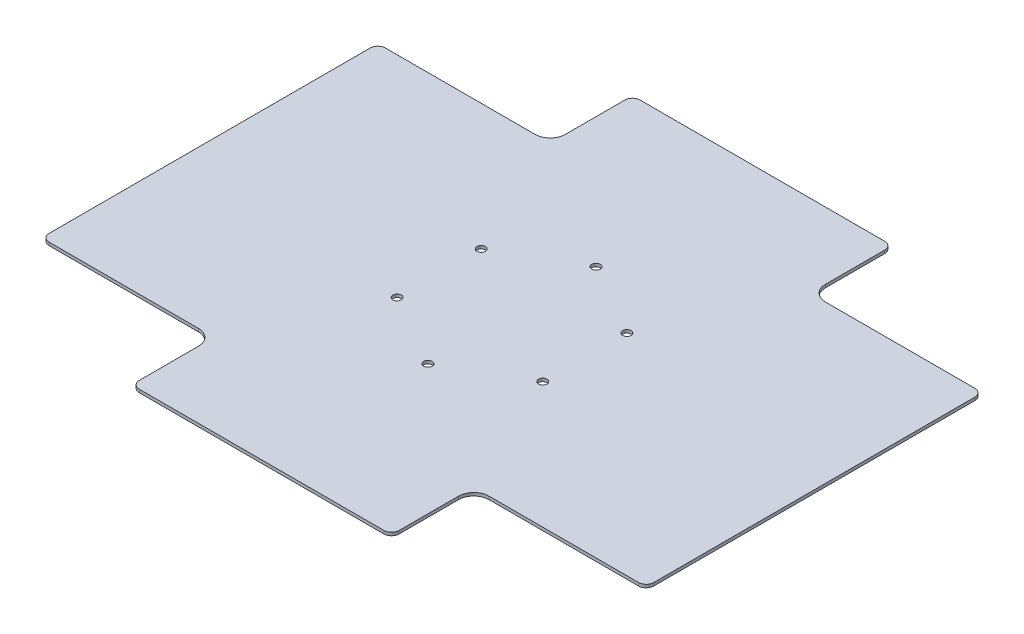
from build123d import *

# Parameters (mm, degrees)
EXTRUDE_1_DEPTH     = 2
SKETCH_4_R          = 2.75
CUT_EXTRUDE_1_DEPTH = 257.804736208


with BuildPart() as part:
    # Эскиз1 → Бобышка-Вытянуть1 (new body)
    with BuildSketch(Plane(origin=(0, 0, 0), x_dir=(1, 0, 0), z_dir=(0, 1, 0))):
        with BuildLine():
            ThreePointArc((-85, -158.805454142), (-83.535533906, -162.340988048), (-80, -163.805454142))
            Line((-80, -163.805454142), (80, -163.805454142))
            ThreePointArc((80, -163.805454142), (83.535533906, -162.340988048), (85, -158.805454142))
            Line((85, -158.805454142), (85, -120))
            ThreePointArc((85, -120), (87.928932188, -112.928932188), (95, -110))
            Line((95, -110), (192.768667216, -110))
            ThreePointArc((192.768667216, -110), (196.304201122, -108.535533906), (197.768667216, -105))
            Line((197.768667216, -105), (197.768667216, 105))
            ThreePointArc((197.768667216, 105), (196.304201122, 108.535533906), (192.768667216, 110))
            Line((192.768667216, 110), (95, 110))
            ThreePointArc((95, 110), (87.928932188, 112.928932188), (85, 120))
            Line((85, 120), (85, 158.805454142))
            ThreePointArc((85, 158.805454142), (83.535533906, 162.340988048), (80, 163.805454142))
            Line((80, 163.805454142), (-80, 163.805454142))
            ThreePointArc((-80, 163.805454142), (-83.535533906, 162.340988048), (-85, 158.805454142))
            Line((-85, 158.805454142), (-85, 120))
            ThreePointArc((-85, 120), (-87.928932188, 112.928932188), (-95, 110))
            Line((-95, 110), (-192.768667216, 110))
            ThreePointArc((-192.768667216, 110), (-196.304201122, 108.535533906), (-197.768667216, 105))
            Line((-197.768667216, 105), (-197.768667216, -105))
            ThreePointArc((-197.768667216, -105), (-196.304201122, -108.535533906), (-192.768667216, -110))
            Line((-192.768667216, -110), (-95, -110))
            ThreePointArc((-95, -110), (-87.928932188, -112.928932188), (-85, -120))
            Line((-85, -120), (-85, -158.805454142))
        make_face()
    extrude(amount=EXTRUDE_1_DEPTH)

    # Эскиз4 → Вырез-Вытянуть1 (cut, through all)
    with BuildSketch(Plane(origin=(0, 2, 0), x_dir=(1, 0, 0), z_dir=(0, 1, 0))):
        with Locations((0, 55)):
            Circle(SKETCH_4_R)
        with Locations((47.631397208, 27.5)):
            Circle(SKETCH_4_R)
        with Locations((47.631397208, -27.5)):
            Circle(SKETCH_4_R)
        with Locations((0, -55)):
            Circle(SKETCH_4_R)
        with Locations((-47.631397208, -27.5)):
            Circle(SKETCH_4_R)
        with Locations((-47.631397208, 27.5)):
            Circle(SKETCH_4_R)
    extrude(amount=-CUT_EXTRUDE_1_DEPTH, mode=Mode.SUBTRACT)


solid = part.part
